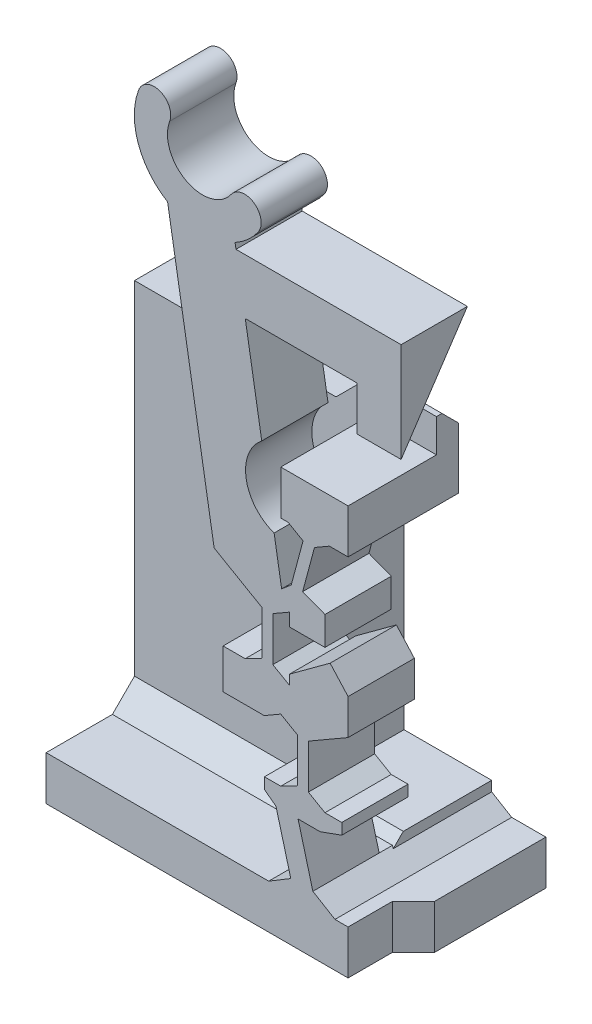
from build123d import *
from OCP.BRepAlgoAPI import BRepAlgoAPI_Cut
from OCP.TopTools import TopTools_ListOfShape

# Parameters (mm, degrees)
BOSS_SWITCH_BODY_DEPTH                    = 3
SKETCH1_W                                 = 4
SKETCH1_H                                 = 3.5
BOSS_FLANGE_WIDTH_DEPTH                   = 5
BOSS_FLANGE_HEIGHT_REACH                  = 35.863
SKETCH2_W                                 = 4
SKETCH2_H                                 = 2
SKETCH2_W_2                               = 8
CUT_UP_TO_DOWN_DERAILLEUR_CLEARANCE_REACH = 21.467
SKETCH10_W                                = 2.453096586
SKETCH10_H                                = 3
SKETCH17_W                                = 12.1675
SKETCH17_H                                = 4
BOSS_FLANGE_SUPPORT_DEPTH                 = 14.506540875
TAP_DRILL_FOR_M2X0_4_TAP1_D               = 1.6
M2_CLEARANCE_HOLE2_D                      = 2.4
M2_CLEARANCE_HOLE2_DEPTH                  = 15
M2_CLEARANCE_HOLE2_TIP                    = 0.721032743
CHAMFER_FLANGE_SUPPORT_SIZE               = 1.5
CHAMFER_FLANGE_SUPPORT_2_SIZE             = 1.5
CHAMFER_FLANGE_SUPPORT_3_SIZE             = 1
SKETCH23_W                                = 3.9675
SKETCH23_H                                = 12.006540875
CUT_GAP_FOR_PRINTING_DEPTH                = 32.000499688
SKETCH25_W                                = 0.953096586
SKETCH25_H                                = 3.5
CUT_DERAILLEUR_CLEARANCE_DEPTH            = 32.145320369
CHAMFER8_SIZE                             = 1
CUT_UP_TO_DOWN_CANTILEVER_SLOPE_REACH     = 31.869
SKETCH26_W                                = 12.477246204
SKETCH26_H                                = 5.771077126
CUT_WIDE_DERAILLEUR_CLEARANCE_DEPTH       = 33.195879702
CUT_WIDE_DERAILLEUR_CLEARANCE_DEPTH_BACK  = 4
SKETCH27_W                                = 2.5
SKETCH27_H                                = 4.999999471
CHAMFER9_SIZE                             = 1.25
SKETCH28_W                                = 3.046903414
SKETCH28_H                                = 1.5
CUT_EXTRUDE1_DEPTH                        = 1


# Some blends are built 0.0001 mm under size
with BuildPart() as part:
    # Sketch-SwitchBossUp → Boss-Switch Body (new body)
    with BuildSketch(Plane.XY):
        with BuildLine():
            Line((5.581091201, 12.555242641), (5.581100766, 11.263016279))
            Line((5.581100766, 11.263016279), (3.971265023, 11.263016279))
            Line((3.971265023, 11.263016279), (3.97126394, 11.842410935))
            Line((3.97126394, 11.842410935), (3.221271341, 11.409402506))
            Line((3.221271341, 11.409402506), (3.221271341, 9.409402506))
            Line((3.221271341, 9.409402506), (3.971278743, 8.976385531))
            Line((3.971278743, 8.976385531), (3.971278743, 9.409408058))
            Line((3.971278743, 9.409408058), (5.815189336, 10.763016279))
            Line((5.815189336, 10.763016279), (6.627976927, 9.860324207))
            Line((6.627976927, 9.860324207), (6.627976927, 8.253837221))
            Line((6.627976927, 8.253837221), (5.581127512, 7.649438429))
            Line((5.581127512, 7.649438429), (4.831138119, 7.216431851))
            Line((4.831138119, 7.216431851), (4.831138119, 5.216431851))
            Line((4.831138119, 5.216431851), (5.58114552, 4.783414875))
            Line((5.58114552, 4.783414875), (6.342350466, 4.783414875))
            Line((6.342350466, 4.783414875), (6.342350466, 4.283414875))
            Line((6.342350466, 4.283414875), (5.364591217, 3.930477929))
            Line((5.364591217, 3.930477929), (4.364591217, 3.930477929))
            Line((4.364591217, 3.930477929), (5.034464198, 1.430477929))
            Line((5.034464198, 1.430477929), (6.034464198, 0.828149001))
            Line((6.034464198, 0.828149001), (6.627976927, 0.828149001))
            Line((6.627976927, 0.828149001), (6.627976927, -1.171850999))
            Line((6.627976927, -1.171850999), (5.034464198, -1.171850999))
            Line((5.034464198, -1.171850999), (3.034464198, -1.171850999))
            Line((3.034464198, -1.171850999), (3.034464198, 0.828149001))
            Line((3.034464198, 0.828149001), (4.034464198, 1.430477929))
            Line((4.034464198, 1.430477929), (3.364591217, 3.930477929))
            Line((3.364591217, 3.930477929), (2.842350466, 4.323450264))
            Line((2.842350466, 4.323450264), (2.842350466, 4.823450264))
            Line((2.842350466, 4.823450264), (3.58114552, 4.823450264))
            Line((3.58114552, 4.823450264), (4.331138119, 5.21642815))
            Line((4.331138119, 5.21642815), (4.331138119, 7.21642815))
            Line((4.331138119, 7.21642815), (3.581130717, 7.649445125))
            Line((3.581130717, 7.649445125), (2.83112652, 7.216422599))
            Line((2.83112652, 7.216422599), (0.971281652, 7.216422599))
            Line((0.971281652, 7.216422599), (0.971281652, 9.016422599))
            Line((0.971281652, 9.016422599), (1.971281652, 9.016422599))
            Line((1.971281652, 9.016422599), (2.721271341, 9.409398805))
            Line((2.721271341, 9.409398805), (2.721271341, 11.409398805))
            Line((2.721271341, 11.409398805), (1.688483029, 12.005679416))
            Line((1.688483029, 12.005679416), (0.565243661, 12.654181967))
            Line((0.565243661, 12.654181967), (-1.541303694, 25.167805745))
            ThreePointArc((-1.541303694, 25.167805745), (-2.872284003, 26.795385437), (-2.852546321, 28.897797067))
            ThreePointArc((-2.852546321, 28.897797067), (-1.887813913, 29.338582026), (-1.447028953, 28.373849618))
            ThreePointArc((-1.447028953, 28.373849618), (-0.703448682, 26.416936722), (1.333779254, 26.898727173))
            ThreePointArc((1.333779254, 26.898727173), (2.379722745, 27.074801628), (2.555797201, 26.028858137))
            ThreePointArc((2.555797201, 26.028858137), (2.086504637, 25.507104397), (1.511513111, 25.104801997))
            Line((1.511513111, 25.104801997), (1.553598189, 24.854801997))
            Line((1.553598189, 24.854801997), (9.027976927, 24.854801997))
            Line((9.027976927, 24.854801997), (9.027976927, 22.354801997))
            Line((9.027976927, 22.354801997), (9.027976927, 20.354801997))
            Line((9.027976927, 20.354801997), (7.027976927, 20.354801997))
            Line((7.027976927, 20.354801997), (7.027976927, 22.354801997))
            Line((7.027976927, 22.354801997), (1.974448974, 22.354801997))
            Line((1.974448974, 22.354801997), (2.719778232, 17.927287042))
            ThreePointArc((2.719778232, 17.927287042), (2.013826204, 16.096957693), (3.280124137, 14.598637521))
            Line((3.280124137, 14.598637521), (3.620297651, 12.577888564))
            Line((3.620297651, 12.577888564), (4.054320079, 12.944956709))
            Line((4.054320079, 12.944956709), (4.59020366, 14.944960676))
            Line((4.59020366, 14.944960676), (3.915161346, 15.334689876))
            Line((3.915161346, 15.334689876), (3.581073513, 15.334689876))
            Line((3.581073513, 15.334689876), (3.581073513, 17.334689876))
            Line((3.581073513, 17.334689876), (5.725580434, 17.334689876))
            Line((5.725580434, 17.334689876), (6.627976927, 17.334689876))
            Line((6.627976927, 17.334689876), (6.627976927, 15.334689876))
            Line((6.627976927, 15.334689876), (5.782854352, 15.334689876))
            Line((5.782854352, 15.334689876), (5.107841751, 14.944964507))
            Line((5.107841751, 14.944964507), (4.571958169, 12.944960541))
            Line((4.571958169, 12.944960541), (5.581091201, 12.555242641))
        make_face()
    extrude(amount=BOSS_SWITCH_BODY_DEPTH)

    # Sketch1 → Boss-Flange Width (add)
    with BuildSketch(Plane(origin=(0, 0, 0), x_dir=(-1, 0, 0), z_dir=(0, 0, -1))):
        Polygon((-7.581073513, -1.171850999), (0.412170615, -1.171850999), (0.412170615, 0.828149001), (-3.034464198, 0.828149001), (-4.034464198, 1.430477929), (-5.034464198, 1.430477929), (-6.034464198, 0.828149001), (-7.581073513, 0.828149001), align=None)
        with Locations((-5.581073513, 17.084689876)):
            Rectangle(SKETCH1_W, SKETCH1_H)
    extrude(amount=BOSS_FLANGE_WIDTH_DEPTH)

    # Sketch2 → Boss-Flange Height (add, up to next)
    with BuildSketch(Plane(origin=(-7.039523073, 0, 0), x_dir=(0, 0, -1), z_dir=(1, 0, 0)), mode=Mode.PRIVATE) as boss_flange_height_sk1:
        with Locations((3, 16.334689876)):
            Rectangle(SKETCH2_W, SKETCH2_H)
    boss_flange_height_tool1 = extrude(boss_flange_height_sk1.sketch, amount=BOSS_FLANGE_HEIGHT_REACH, mode=Mode.PRIVATE) - part.part
    # Sketch2 → Boss-Flange Height (add, up to next)
    with BuildSketch(Plane(origin=(-7.039523073, 0, 0), x_dir=(0, 0, -1), z_dir=(1, 0, 0)), mode=Mode.PRIVATE) as boss_flange_height_sk2:
        with Locations((1, -0.171850999)):
            Rectangle(SKETCH2_W_2, SKETCH2_H)
    boss_flange_height_tool2 = extrude(boss_flange_height_sk2.sketch, amount=BOSS_FLANGE_HEIGHT_REACH, mode=Mode.PRIVATE) - part.part
    add(boss_flange_height_tool1.solids().sort_by_distance((-7.039523, 16.33469, -3))[0])
    add(boss_flange_height_tool2.solids().sort_by_distance((-7.039523, -0.171851, -1))[0])

    # Sketch10 → Cut-Up-To-Down Derailleur Clearance (cut, up to next)
    with BuildSketch(Plane(origin=(0, 15.334689876, 0), x_dir=(1, 0, 0), z_dir=(0, 1, 0)), mode=Mode.PRIVATE) as cut_up_to_down_derailleur_clearance_sk1:
        with Locations((6.35452522, 3.5)):
            Rectangle(SKETCH10_W, SKETCH10_H)
    cut_up_to_down_derailleur_clearance_tool1 = extrude(cut_up_to_down_derailleur_clearance_sk1.sketch, amount=CUT_UP_TO_DOWN_DERAILLEUR_CLEARANCE_REACH, mode=Mode.PRIVATE) & part.part
    add(cut_up_to_down_derailleur_clearance_tool1.solids().sort_by_distance((6.354525, 15.33469, -3.5))[0], mode=Mode.SUBTRACT)

    # Sketch17 → Boss-Flange Support (add)
    with BuildSketch(Plane.XZ.offset(-15.334689876)):
        with Locations((-0.955773073, -3)):
            Rectangle(SKETCH17_W, SKETCH17_H)
    extrude(amount=BOSS_FLANGE_SUPPORT_DEPTH)

    # Tap Drill for M2x0.4 Tap1 (through all)
    with Locations(Plane(origin=(0, -1.171850999, 0), x_dir=(-1, 0, 0), z_dir=(0, -1, 0))):
        with Locations((5.039523073, 3), (0.539523073, 3)):
            Hole(TAP_DRILL_FOR_M2X0_4_TAP1_D / 2)

    # M2 Clearance Hole2
    with Locations(Plane.XZ.offset(1.171850999)):
        with Locations((-5.039523073, -3), (-0.539523073, -3)):
            Hole(M2_CLEARANCE_HOLE2_D / 2, depth=M2_CLEARANCE_HOLE2_DEPTH)
            with Locations((0, 0, -(M2_CLEARANCE_HOLE2_DEPTH + M2_CLEARANCE_HOLE2_TIP / 2))):  # 118° drill point
                Cone(0, M2_CLEARANCE_HOLE2_D / 2, M2_CLEARANCE_HOLE2_TIP, mode=Mode.SUBTRACT)

    # Chamfer-Flange Support
    chamfer_flange_support_edges = [part.edges().sort_by_distance(p)[0] for p in [
        (3.581073513, 17.334689876, -3),
    ]]
    chamfer(chamfer_flange_support_edges, length=CHAMFER_FLANGE_SUPPORT_SIZE - 0.0001)  # a hair under: the kernel refuses the full size

    # Chamfer-Flange Support 2
    chamfer_flange_support_2_edges = [part.edges().sort_by_distance(p)[0] for p in [
        (5.127976927, 17.084689876, -2),
        (5.127976927, 15.334689876, -1.5),
    ]]
    chamfer(chamfer_flange_support_2_edges, length=CHAMFER_FLANGE_SUPPORT_2_SIZE)

    # Chamfer-Flange Support 3
    chamfer_flange_support_3_edges = [part.edges().sort_by_distance(p)[0] for p in [
        (-2.002529437, 0.828149001, -1),
    ]]
    chamfer(chamfer_flange_support_3_edges, length=CHAMFER_FLANGE_SUPPORT_3_SIZE)

    # Sketch23 → Cut-Gap for Printing (cut, through all)
    with BuildSketch(Plane.XY.offset(-1)):
        with Locations((3.144226927, 7.831419439)):
            Rectangle(SKETCH23_W, SKETCH23_H)
    extrude(amount=-CUT_GAP_FOR_PRINTING_DEPTH, mode=Mode.SUBTRACT)

    # Sketch25 → Cut-Derailleur Clearance (cut, through all)
    with BuildSketch(Plane.XY):
        with Locations((7.10452522, 17.084689876)):
            Rectangle(SKETCH25_W, SKETCH25_H)
    extrude(amount=-CUT_DERAILLEUR_CLEARANCE_DEPTH, mode=Mode.SUBTRACT)

    # Chamfer8
    # the kernel refuses this chamfer: 1 mm, written as the material it adds along each edge
    with BuildSketch(Plane(origin=(6.627976927, 0.828149001, 0), x_dir=(1, 0, 0), z_dir=(0, -1, 0))) as chamfer8_piece_1_section:
        Polygon((CHAMFER8_SIZE, 0), (0, CHAMFER8_SIZE), (0, 0), align=None)
    chamfer8_piece_1 = extrude(amount=2, mode=Mode.PRIVATE)
    chamfer8_piece_1 = split(chamfer8_piece_1, bisect_by=Plane(origin=(7.581073513, 0.828149001, 0), z_dir=(-1, 0, 0)), keep=Keep.TOP, mode=Mode.PRIVATE)
    add(chamfer8_piece_1)

    # Sketch26 → Cut-Up-to-Down Cantilever Slope (cut, up to next)
    with BuildSketch(Plane(origin=(-3.086642121, 5.589000146, 8.383500218), x_dir=(-0.9561404375276108, -0.1624764728289173, -0.24371470924337582), z_dir=(0.2929086269205964, -0.5303712883154423, -0.795556932473163)), mode=Mode.PRIVATE) as cut_up_to_down_cantilever_slope_sk1:
        with Locations((-13.791615152, 17.794906754)):
            Rectangle(SKETCH26_W, SKETCH26_H)
    cut_up_to_down_cantilever_slope_tool1 = extrude(cut_up_to_down_cantilever_slope_sk1.sketch, amount=CUT_UP_TO_DOWN_CANTILEVER_SLOPE_REACH, mode=Mode.PRIVATE) & part.part
    add(cut_up_to_down_cantilever_slope_tool1.solids().sort_by_distance((10.100079, 22.636071, 1.873881))[0], mode=Mode.SUBTRACT)


with BuildPart() as cut_wide_derailleur_clearance_tool:
    # Sketch27 → Cut-Wide Derailleur Clearance (new, two sides: drawn at the far end of the back side and taken through both)
    with BuildSketch(Plane(origin=(5.127976927, 0, 0), x_dir=(0, 0, -1), z_dir=(1, 0, 0)).offset(-CUT_WIDE_DERAILLEUR_CLEARANCE_DEPTH_BACK)):
        with Locations((3.75, 16.334689611)):
            Rectangle(SKETCH27_W, SKETCH27_H)
    extrude(amount=CUT_WIDE_DERAILLEUR_CLEARANCE_DEPTH + CUT_WIDE_DERAILLEUR_CLEARANCE_DEPTH_BACK)


with BuildPart() as part_1:
    add(part.part)

    # Cut-Wide Derailleur Clearance: cut by cut_wide_derailleur_clearance_tool, with a tolerance
    cut_wide_derailleur_clearance_stock = TopTools_ListOfShape()
    cut_wide_derailleur_clearance_stock.Append(part_1.part.wrapped)
    cut_wide_derailleur_clearance_tools = TopTools_ListOfShape()
    cut_wide_derailleur_clearance_tools.Append(cut_wide_derailleur_clearance_tool.part.wrapped)
    cut_wide_derailleur_clearance_cut = BRepAlgoAPI_Cut()
    cut_wide_derailleur_clearance_cut.SetArguments(cut_wide_derailleur_clearance_stock)
    cut_wide_derailleur_clearance_cut.SetTools(cut_wide_derailleur_clearance_tools)
    cut_wide_derailleur_clearance_cut.SetFuzzyValue(0.00001)
    cut_wide_derailleur_clearance_cut.Build()
    add(Compound.cast(cut_wide_derailleur_clearance_cut.Shape()).solids(), mode=Mode.REPLACE)

    # Chamfer9
    chamfer9_edges = [part_1.edges().sort_by_distance(p)[0] for p in [
        (4.85452522, 18.834689347, -2.5),
    ]]
    chamfer(chamfer9_edges, length=CHAMFER9_SIZE)

    # Sketch28 → Cut-Extrude1 (cut)
    with BuildSketch(Plane.XY.offset(-1)):
        with Locations((5.10452522, 18.084689876)):
            Rectangle(SKETCH28_W, SKETCH28_H)
    extrude(amount=CUT_EXTRUDE1_DEPTH, mode=Mode.SUBTRACT)


solid = part_1.part
